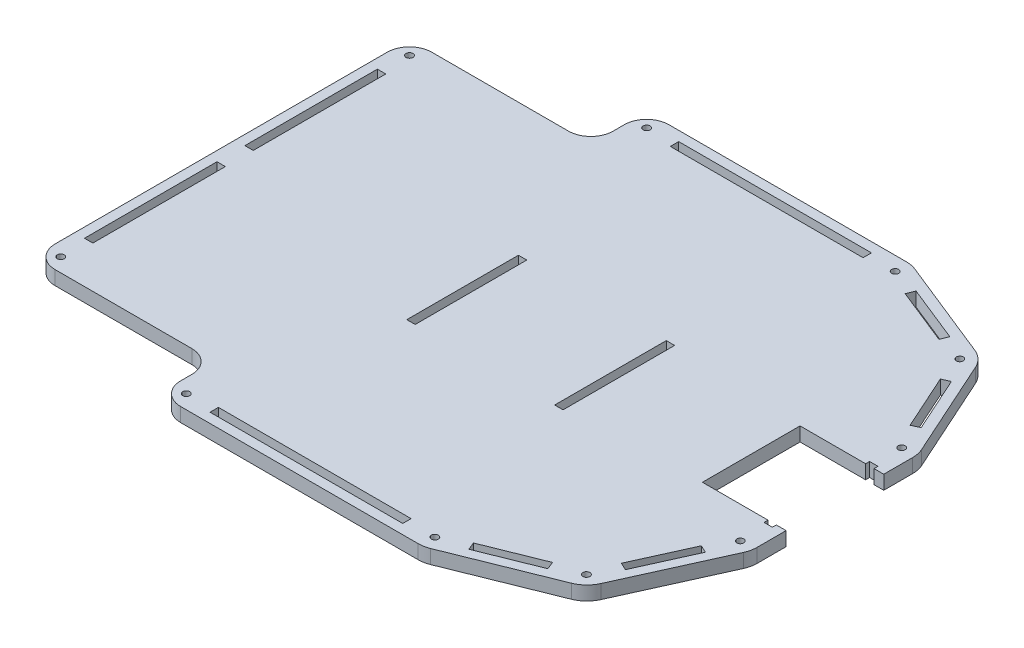
from build123d import *

# Parameters (mm, degrees)
ESTRUSIONE_ESTRUSIONE1_DEPTH  = 5
FORO_FILETTATO_M3X0_5_1_D     = 2.5
FORO_FILETTATO_M3X0_5_1_DEPTH = 7.5
FORO_FILETTATO_M3X0_5_1_TIP   = 0.751075774
SCHIZZO4_W                    = 69.084596206
SCHIZZO4_H                    = 3
TAGLIO_ESTRUSIONE2_DEPTH      = 10
SCHIZZO7_W                    = 3
SCHIZZO7_H                    = 47.5
TAGLIO_ESTRUSIONE5_DEPTH      = 10
SCHIZZO12_W                   = 3
SCHIZZO12_H                   = 40
TAGLIO_ESTRUSIONE8_DEPTH      = 237.814801058
TAGLIO_ESTRUSIONE1_DEPTH      = 237.814801058
TAGLIO_ESTRUSIONE1_DEPTH_BACK = 237.814801058
SCHIZZO11_W                   = 3
SCHIZZO11_H                   = 1.42393853
TAGLIO_ESTRUSIONE7_DEPTH      = 5
RACCORDO1_R                   = 8
RACCORDO2_R                   = 10


with BuildPart() as part:
    # Schizzo1 → Estrusione-Estrusione1 (new body)
    with BuildSketch(Plane(origin=(0, 0, 0), x_dir=(1, 0, 0), z_dir=(0, 1, 0))):
        Polygon((65, 67.5), (65, 87.5), (160.052105959, 87.5), (201.585225273, 70.801270189), (220, 30), (220, -30), (201.585225273, -70.801270189), (160.052105959, -87.5), (65, -87.5), (65, -67.5), (0, -67.5), (0, 67.5), align=None)
    extrude(amount=ESTRUSIONE_ESTRUSIONE1_DEPTH)

    # Foro filettato M3x0.5-1
    with Locations(Plane(origin=(0, 5, 0), x_dir=(1, 0, 0), z_dir=(0, 1, 0))):
        with Locations((197.854862265, 66.912097904), (215, 28.92393853), (215, -28.92393853), (197.854862265, -66.912097904), (159.084596206, -82.5), (159.084596206, 82.5), (70, 82.5), (70, -82.5), (5, -62.5), (5, 62.5)):
            Hole(FORO_FILETTATO_M3X0_5_1_D / 2, depth=FORO_FILETTATO_M3X0_5_1_DEPTH)
            with Locations((0, 0, -(FORO_FILETTATO_M3X0_5_1_DEPTH + FORO_FILETTATO_M3X0_5_1_TIP / 2))):  # 118° drill point
                Cone(0, FORO_FILETTATO_M3X0_5_1_D / 2, FORO_FILETTATO_M3X0_5_1_TIP, mode=Mode.SUBTRACT)

    # Schizzo4 → Taglio-Estrusione2 (cut)
    with BuildSketch(Plane(origin=(0, 5, 0), x_dir=(1, 0, 0), z_dir=(0, 1, 0))):
        with Locations((114.542298103, -82.5)):
            Rectangle(SCHIZZO4_W, SCHIZZO4_H)
        Polygon((209.519084515, 37.421559693), (200.601374282, 57.180362615), (203.33577775, 58.414476741), (212.253487983, 38.655673819), align=None)
        with Locations((114.542298103, 82.5)):
            Rectangle(SCHIZZO4_W, SCHIZZO4_H)
        Polygon((189.136249234, 72.034186035), (168.92231814, 80.161362114), (167.803209237, 77.377911869), (188.017140331, 69.250735791), align=None)
        Polygon((167.803209237, -77.377911869), (188.017140331, -69.250735791), (189.136249234, -72.034186035), (168.92231814, -80.161362114), align=None)
        Polygon((200.601374282, -57.180362615), (209.519084515, -37.421559693), (212.253487983, -38.655673819), (203.33577775, -58.414476741), align=None)
    extrude(amount=-TAGLIO_ESTRUSIONE2_DEPTH, mode=Mode.SUBTRACT)

    # Schizzo7 → Taglio-Estrusione5 (cut)
    with BuildSketch(Plane(origin=(0, 5, 0), x_dir=(1, 0, 0), z_dir=(0, 1, 0))):
        with Locations((5, 28.75)):
            Rectangle(SCHIZZO7_W, SCHIZZO7_H)
        with Locations((5, -28.75)):
            Rectangle(SCHIZZO7_W, SCHIZZO7_H)
    extrude(amount=-TAGLIO_ESTRUSIONE5_DEPTH, mode=Mode.SUBTRACT)

    # Schizzo12 → Taglio-Estrusione8 (cut, through all)
    with BuildSketch(Plane(origin=(0, 5, 0), x_dir=(1, 0, 0), z_dir=(0, 1, 0))):
        with Locations((88.042298103, 0)):
            Rectangle(SCHIZZO12_W, SCHIZZO12_H)
        with Locations((141.042298103, 0)):
            Rectangle(SCHIZZO12_W, SCHIZZO12_H)
    extrude(amount=-TAGLIO_ESTRUSIONE8_DEPTH, mode=Mode.SUBTRACT)

    # Schizzo2 → Taglio-Estrusione1 (cut, two sides: drawn at the far end of the back side and taken through both)
    with BuildSketch(Plane(origin=(0, 5, 0), x_dir=(1, 0, 0), z_dir=(0, 1, 0)).offset(-TAGLIO_ESTRUSIONE1_DEPTH_BACK)):
        Polygon((717.54486973, 17.5), (220, 17.5), (190, 17.5), (190, -17.5), (220, -17.5), (717.54486973, -17.5), (1712.63460919, -17.5), (1712.63460919, 17.5), align=None)
    extrude(amount=TAGLIO_ESTRUSIONE1_DEPTH + TAGLIO_ESTRUSIONE1_DEPTH_BACK, mode=Mode.SUBTRACT)

    # Schizzo11 → Taglio-Estrusione7 (cut)
    with BuildSketch(Plane(origin=(0, 5, 0), x_dir=(1, 0, 0), z_dir=(0, 1, 0))):
        with Locations((215, -18.211969265)):
            Rectangle(SCHIZZO11_W, SCHIZZO11_H)
        with Locations((215, 18.211969265)):
            Rectangle(SCHIZZO11_W, SCHIZZO11_H)
    extrude(amount=-TAGLIO_ESTRUSIONE7_DEPTH, mode=Mode.SUBTRACT)

    # Raccordo1
    raccordo1_edges = [part.edges().sort_by_distance(p)[0] for p in [
        (0, 2.5, 67.5),
        (0, 2.5, -67.5),
        (65, 2.5, -87.5),
        (65, 2.5, 87.5),
        (65, 2.5, 67.5),
        (65, 2.5, -67.5),
    ]]
    fillet(raccordo1_edges, radius=RACCORDO1_R)

    # Raccordo2
    raccordo2_edges = [part.edges().sort_by_distance(p)[0] for p in [
        (160.052105959, 2.5, -87.5),
        (201.585225273, 2.5, -70.801270189),
        (220, 2.5, -30),
        (220, 2.5, 30),
        (201.585225273, 2.5, 70.801270189),
        (160.052105959, 2.5, 87.5),
    ]]
    fillet(raccordo2_edges, radius=RACCORDO2_R)


solid = part.part
